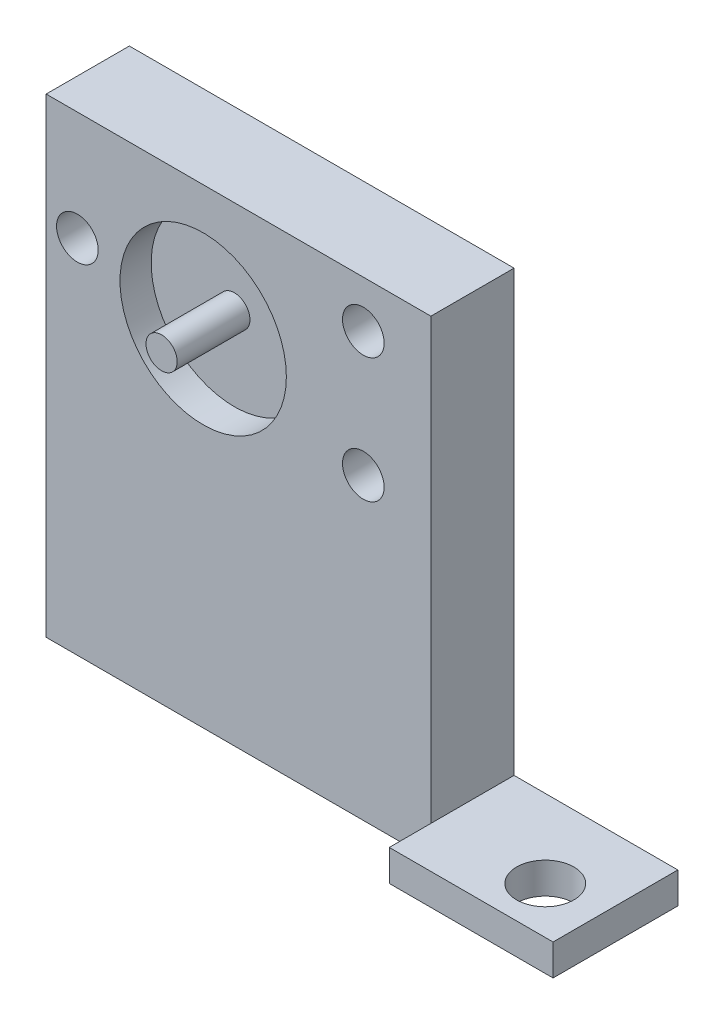
from build123d import *

# Parameters (mm, degrees)
ESQUISSE1_W             = 37
ESQUISSE1_H             = 42.25
ESQUISSE1_R             = 6
BOSS_EXTRU_1_DEPTH      = 12
ESQUISSE2_R             = 6
ESQUISSE2_R_2           = 1.5
ENL_V_MAT_EXTRU_1_DEPTH = 3
ESQUISSE3_W             = 37
ESQUISSE3_H             = 12
ESQUISSE3_W_2           = 15.75
ESQUISSE3_R             = 2.75
BOSS_EXTRU_2_DEPTH      = 3
ESQUISSE4_W             = 37
ESQUISSE4_H             = 45.25
ESQUISSE4_R             = 8
ENL_V_MAT_EXTRU_2_DEPTH = 4
ESQUISSE4_3_R           = 8
ESQUISSE4_3_R_2         = 6
ESQUISSE4_3_R_3         = 1.5
ENL_V_MAT_EXTRU_4_DEPTH = 7
CONG_2_R                = 5
CONG_3_R                = 5
ESQUISSE5_R             = 2
ENL_V_MAT_EXTRU_5_DEPTH = 43.650652105
BOSS_EXTRU_3_START      = 2
ESQUISSE2_2_R           = 1.5
BOSS_EXTRU_3_DEPTH      = 2
SYM_TRIE1_OUTLINE_W     = 37
SYM_TRIE1_OUTLINE_H     = 45.25
SYM_TRIE1_OUTLINE_R     = 8
SYM_TRIE1_OUTLINE_R_2   = 2
SYM_TRIE1_OUTLINE_R_3   = 1.5
SYM_TRIE1_DEPTH         = 8
SYM_TRIE1_2_OUTLINE_W   = 15.75
SYM_TRIE1_2_OUTLINE_H   = 3
SYM_TRIE1_2_OUTLINE_R   = 8
SYM_TRIE1_2_OUTLINE_R_2 = 1.5
SYM_TRIE1_2_DEPTH       = 4.7499999
SYM_TRIE1_START         = 10.2500001
SYM_TRIE1_3_OUTLINE_W   = 15.75
SYM_TRIE1_3_OUTLINE_H   = 3
SYM_TRIE1_3_OUTLINE_R   = 1.5
SYM_TRIE1_3_DEPTH       = 1.7499999
SYM_TRIE1_START_2       = 1.13256
SYM_TRIE1_4_OUTLINE_R   = 8
SYM_TRIE1_4_OUTLINE_R_2 = 1.5
SYM_TRIE1_4_DEPTH       = 3.86744
SYM_TRIE1_START_3       = 8
SYM_TRIE1_5_OUTLINE_R   = 1.5
SYM_TRIE1_5_DEPTH       = 2.73256
SYM_TRIE1_START_4       = -24.125
SYM_TRIE1_6_DEPTH       = 3
ESQUISSE6_W             = 14
ESQUISSE6_H             = 45.25
ENL_V_MAT_EXTRU_6_DEPTH = 60.670580063


with BuildPart() as part:
    # Esquisse1 → Boss.-Extru.1 (new body)
    # profile 1 of 2: a face of its own
    with BuildSketch(Plane.XY):
        Rectangle(ESQUISSE1_W, ESQUISSE1_H)
        with Locations((3.4, 9.125)):
            Circle(ESQUISSE1_R, mode=Mode.SUBTRACT)
    # profile 2 of 2: a face of its own
    with BuildSketch(Plane.XY):
        with Locations((3.4, 9.125)):
            Circle(ESQUISSE1_R)
    extrude(amount=BOSS_EXTRU_1_DEPTH)

    # Esquisse2 → Enlèv. mat.-Extru.1 (cut)
    with BuildSketch(Plane.XY.offset(12)):
        with Locations((3.4, 9.125)):
            Circle(ESQUISSE2_R)
        with Locations((3.4, 9.125)):
            Circle(ESQUISSE2_R_2, mode=Mode.SUBTRACT)
    extrude(amount=-ENL_V_MAT_EXTRU_1_DEPTH, mode=Mode.SUBTRACT)

    # Esquisse3 → Boss.-Extru.2 (add)
    # profile 1 of 2: a face of its own
    with BuildSketch(Plane.XZ.offset(21.125)):
        with Locations((0, 6)):
            Rectangle(ESQUISSE3_W, ESQUISSE3_H)
    # profile 2 of 2: a face of its own
    with BuildSketch(Plane.XZ.offset(21.125)):
        with Locations((-26.375, 6)):
            Rectangle(ESQUISSE3_W_2, ESQUISSE3_H)
        with Locations((-29, 7.5)):
            Circle(ESQUISSE3_R, mode=Mode.SUBTRACT)
    extrude(amount=BOSS_EXTRU_2_DEPTH)

    # Esquisse4 → Enlèv. mat.-Extru.2 (cut)
    with BuildSketch(Plane.XY.offset(12)):
        with Locations((0, -1.5)):
            Rectangle(ESQUISSE4_W, ESQUISSE4_H)
        with Locations((3.4, 9.125)):
            Circle(ESQUISSE4_R, mode=Mode.SUBTRACT)
    extrude(amount=-ENL_V_MAT_EXTRU_2_DEPTH, mode=Mode.SUBTRACT)

    # Esquisse4<3> → Enlèv. mat.-Extru.4 (cut)
    # profile 1 of 2: a face of its own
    with BuildSketch(Plane.XY.offset(12)):
        with Locations((3.4, 9.125)):
            Circle(ESQUISSE4_3_R)
        with Locations((3.4, 9.125)):
            Circle(ESQUISSE4_3_R_2, mode=Mode.SUBTRACT)
    # profile 2 of 2: a face of its own
    with BuildSketch(Plane.XY.offset(12)):
        with Locations((3.4, 9.125)):
            Circle(ESQUISSE4_3_R_2)
        with Locations((3.4, 9.125)):
            Circle(ESQUISSE4_3_R_3, mode=Mode.SUBTRACT)
    extrude(amount=-ENL_V_MAT_EXTRU_4_DEPTH, mode=Mode.SUBTRACT)

    # Congé2
    # the kernel refuses this fillet: 5 mm, written as the material it adds along each edge
    with BuildSketch(Plane(origin=(-18.5, -24.125, 8), x_dir=(1.5667467323505199e-12, 0, 1.0), z_dir=(0, 1, 0))) as cong_2_piece_1:
        with BuildLine():
            CenterArc((5, 4.898979486), CONG_2_R, 180, 78.463040967)
            Line((0, 4.898979486), (0, 0))
            Line((0, 0), (4, 0))
        make_face()
    extrude(amount=3)

    # Congé3
    cong_3_edges = [part.edges().sort_by_distance(p)[0] for p in [
        (-18.5, -22.625, 12),
    ]]
    fillet(cong_3_edges, radius=CONG_3_R)

    # Esquisse5 → Enlèv. mat.-Extru.5 (cut, through all)
    with BuildSketch(Plane.XY.offset(8)):
        with Locations((-12, 16.625)):
            Circle(ESQUISSE5_R)
        with Locations((-12, 4.625)):
            Circle(ESQUISSE5_R)
        with Locations((15.5, 10.625)):
            Circle(ESQUISSE5_R)
    extrude(amount=-ENL_V_MAT_EXTRU_5_DEPTH, mode=Mode.SUBTRACT)

    # Esquisse2<2> → Boss.-Extru.3 (add)
    with BuildSketch(Plane.XY.offset(12).offset(BOSS_EXTRU_3_START)):
        with Locations((3.4, 9.125)):
            Circle(ESQUISSE2_2_R)
    extrude(amount=-BOSS_EXTRU_3_DEPTH)

    # Symétrie1: read off the stored shape, not the designer's step
    # Symétrie1 outline → Symétrie1 (add)
    # profile 1 of 2: a face of its own
    with BuildSketch(Plane.XY):
        with Locations((37, -1.5)):
            Rectangle(SYM_TRIE1_OUTLINE_W, SYM_TRIE1_OUTLINE_H)
        with Locations((33.6, 9.125)):
            Circle(SYM_TRIE1_OUTLINE_R, mode=Mode.SUBTRACT)
        with Locations((21.5, 10.625)):
            Circle(SYM_TRIE1_OUTLINE_R_2, mode=Mode.SUBTRACT)
        with Locations((49, 4.625)):
            Circle(SYM_TRIE1_OUTLINE_R_2, mode=Mode.SUBTRACT)
        with Locations((49, 16.625)):
            Circle(SYM_TRIE1_OUTLINE_R_2, mode=Mode.SUBTRACT)
    # profile 2 of 2: a face of its own
    with BuildSketch(Plane.XY):
        with Locations((33.6, 9.125)):
            Circle(SYM_TRIE1_OUTLINE_R_3)
    extrude(amount=SYM_TRIE1_DEPTH)

    # Sym_trie1 2 outline → Sym_trie1 2 (add)
    # profile 1 of 2: a face of its own
    with BuildSketch(Plane.XY):
        with Locations((63.375, -22.625)):
            Rectangle(SYM_TRIE1_2_OUTLINE_W, SYM_TRIE1_2_OUTLINE_H)
    # profile 2 of 2: a face of its own
    with BuildSketch(Plane.XY):
        with Locations((33.6, 9.125)):
            Circle(SYM_TRIE1_2_OUTLINE_R)
        with Locations((33.6, 9.125)):
            Circle(SYM_TRIE1_2_OUTLINE_R_2, mode=Mode.SUBTRACT)
    extrude(amount=SYM_TRIE1_2_DEPTH)

    # Sym_trie1 4 outline → Sym_trie1 4 (add)
    with BuildSketch(Plane.XY.offset(SYM_TRIE1_START_2)):
        with Locations((33.6, 9.125)):
            Circle(SYM_TRIE1_4_OUTLINE_R)
        with Locations((33.6, 9.125)):
            Circle(SYM_TRIE1_4_OUTLINE_R_2, mode=Mode.SUBTRACT)
    extrude(amount=SYM_TRIE1_4_DEPTH)



with BuildPart() as body_2:
    # Sym_trie1 3 outline → Sym_trie1 3 (new body)
    with BuildSketch(Plane.XY.offset(SYM_TRIE1_START)):
        with Locations((63.375, -22.625)):
            Rectangle(SYM_TRIE1_3_OUTLINE_W, SYM_TRIE1_3_OUTLINE_H)
        with Locations((33.6, 9.125)):
            Circle(SYM_TRIE1_3_OUTLINE_R)
    extrude(amount=SYM_TRIE1_3_DEPTH)


with BuildPart() as part_1:
    add(part.part)

    add(body_2.part)  # Sym_trie1 5 merges body 2
    # Sym_trie1 5 outline → Sym_trie1 5 (add)
    with BuildSketch(Plane.XY.offset(SYM_TRIE1_START_3)):
        with Locations((33.6, 9.125)):
            Circle(SYM_TRIE1_5_OUTLINE_R)
    extrude(amount=SYM_TRIE1_5_DEPTH)

    # Sym_trie1 6 outline → Sym_trie1 6 (add)
    with BuildSketch(Plane(origin=(0, 0, 0), x_dir=(1, 0, 0), z_dir=(0, 1, 0)).offset(SYM_TRIE1_START_4)):
        with BuildLine():
            Line((66, -10.25), (71.25, -10.2500001))
            Line((71.25, -10.2500001), (71.25, -4.7499999))
            Line((71.25, -4.7499999), (66, -4.75))
            ThreePointArc((66, -4.75), (68.75, -7.5), (66, -10.25))
        make_face()
        with BuildLine():
            Line((55.5, -10.2500001), (66, -10.25))
            ThreePointArc((66, -10.25), (63.25, -7.5), (66, -4.75))
            Line((66, -4.75), (55.5, -4.7499999))
            Line((55.5, -4.7499999), (55.5, -10.2500001))
        make_face()
    extrude(amount=SYM_TRIE1_6_DEPTH)

    # Esquisse6 → Enlèv. mat.-Extru.6 (cut, through all)
    with BuildSketch(Plane(origin=(18.5, 0, 0), x_dir=(0, 0, -1), z_dir=(1, 0, 0))):
        with Locations((-7, -1.5)):
            Rectangle(ESQUISSE6_W, ESQUISSE6_H)
    extrude(amount=-ENL_V_MAT_EXTRU_6_DEPTH, mode=Mode.SUBTRACT)


solid = part_1.part
